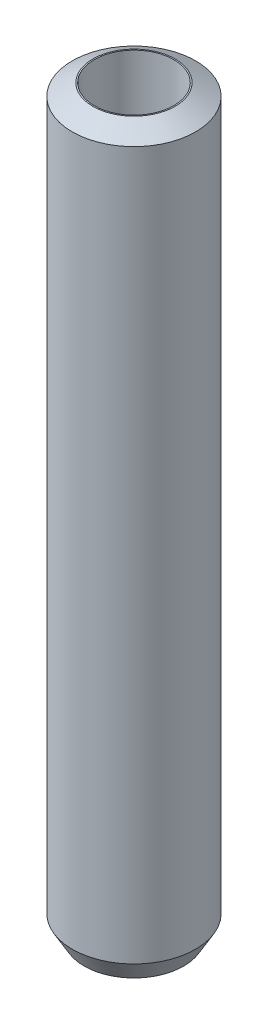
from build123d import *
from OCP.BRepFilletAPI import BRepFilletAPI_MakeChamfer

# Parameters (mm, degrees)
SKETCH1_R           = 10
BOSS_EXTRUDE1_DEPTH = 120.069179777
SKETCH2_R           = 6.462133693
CUT_EXTRUDE1_DEPTH  = 121.899164317
CHAMFER1_SIZE       = 1.922339493
CHAMFER1_SIZE2      = 3.32958967


with BuildPart() as part:
    # Sketch1 → Boss-Extrude1 (new body)
    with BuildSketch(Plane(origin=(0, 0, 0), x_dir=(1, 0, 0), z_dir=(0, 1, 0))):
        Circle(SKETCH1_R)
    extrude(amount=BOSS_EXTRUDE1_DEPTH)

    # Sketch2 → Cut-Extrude1 (cut, through all)
    with BuildSketch(Plane(origin=(0, 0, 0), x_dir=(1, 0, 0), z_dir=(0, 1, 0))):
        Circle(SKETCH2_R)
    extrude(amount=CUT_EXTRUDE1_DEPTH, mode=Mode.SUBTRACT)

    # Chamfer1: one chamfer whose edges measure the first distance from different faces: ONE call of the kernel's chamfer builder (chamfer() names one face for all edges)
    chamfer1_edges_1 = [part.edges().sort_by_distance(p)[0] for p in [
        (-10, 120.069179777, 0),
    ]]
    chamfer1_side_1 = [part.faces().sort_by_distance(p)[0] for p in [
        (-10, 60.034589889, 0),
    ]]
    chamfer1_edges_2 = [part.edges().sort_by_distance(p)[0] for p in [
        (-10, 0, 0),
    ]]
    chamfer1_side_2 = [part.faces().sort_by_distance(p)[0] for p in [
        (-9.717157288, 0, 0),
    ]]
    chamfer1 = BRepFilletAPI_MakeChamfer(part.part.solid().wrapped)
    for e in chamfer1_edges_1:
        chamfer1.Add(CHAMFER1_SIZE, CHAMFER1_SIZE2, e.wrapped, chamfer1_side_1[0].wrapped)  # the first distance lies on this face
    for e in chamfer1_edges_2:
        chamfer1.Add(CHAMFER1_SIZE, CHAMFER1_SIZE2, e.wrapped, chamfer1_side_2[0].wrapped)  # the first distance lies on this face
    add(Compound.cast(chamfer1.Shape()), mode=Mode.REPLACE)


solid = part.part
